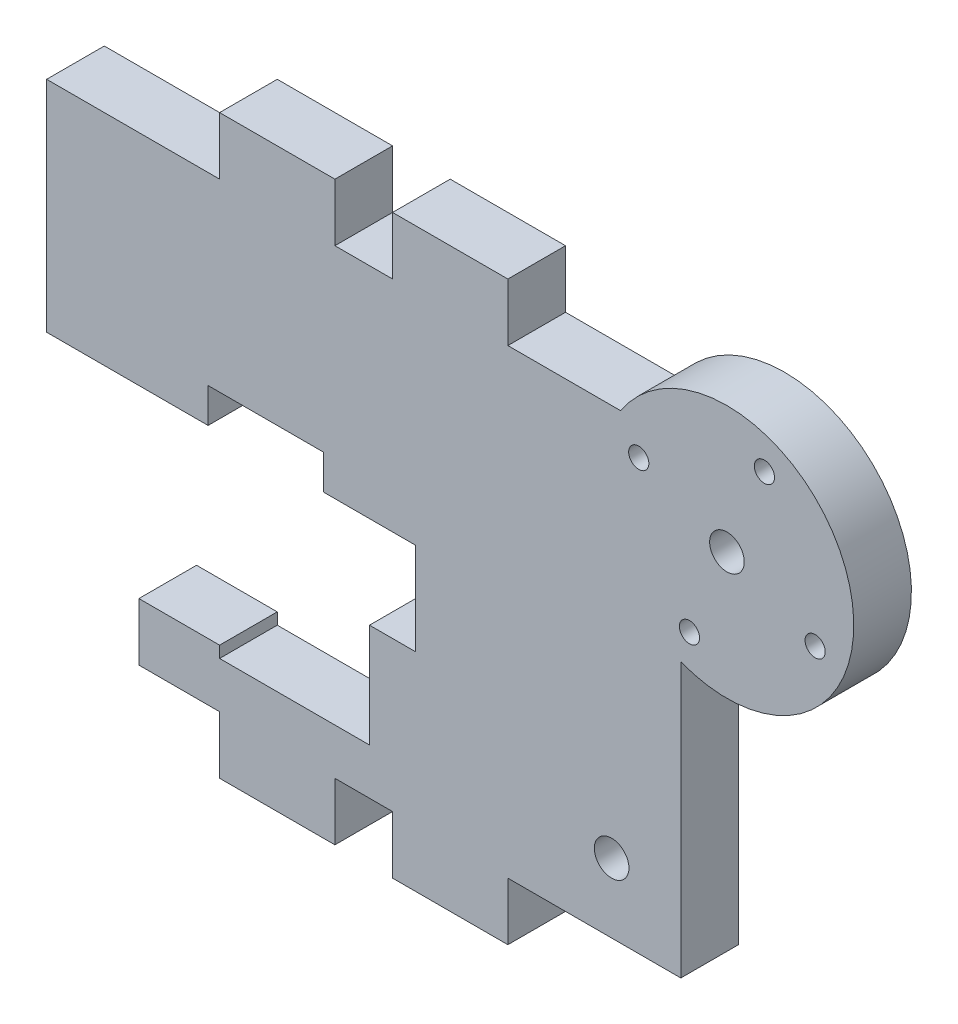
from build123d import *

# Parameters (mm, degrees)
ESQUISSE1_R        = 1.5
ESQUISSE1_R_2      = 0.875
BOSS_EXTRU_1_DEPTH = 5


with BuildPart() as part:
    # Esquisse1 → Boss.-Extru.1 (new body)
    with BuildSketch(Plane.XY):
        with BuildLine():
            Line((10, -5), (10, 0))
            Line((10, 0), (15, 0))
            Line((15, 0), (15, -5))
            Line((15, -5), (25, -5))
            Line((25, -5), (25, 0))
            Line((25, 0), (40, 0))
            Line((40, 0), (40, 23.753049234))
            ThreePointArc((40, 23.753049234), (54.472819163, 37.364529505), (34.780455543, 40))
            Line((34.780455543, 40), (25, 40))
            Line((25, 40), (25, 45))
            Line((25, 45), (15, 45))
            Line((15, 45), (15, 40))
            Line((15, 40), (10, 40))
            Line((10, 40), (10, 45))
            Line((10, 45), (0, 45))
            Line((0, 45), (0, 40))
            Line((0, 40), (-15, 40))
            Line((-15, 40), (-15, 21))
            Line((-15, 21), (-1, 21))
            Line((-1, 21), (-1, 24))
            Line((-1, 24), (9, 24))
            Line((9, 24), (9, 21))
            Line((9, 21), (17, 21))
            Line((17, 21), (17, 13))
            Line((17, 13), (13, 13))
            Line((13, 13), (13, 4))
            Line((13, 4), (0, 4))
            Line((0, 4), (0, 5))
            Line((0, 5), (-7, 5))
            Line((-7, 5), (-7, 0))
            Line((-7, 0), (0, 0))
            Line((0, 0), (0, -5))
            Line((0, -5), (10, -5))
        make_face()
        with Locations((34, 6)):
            Circle(ESQUISSE1_R, mode=Mode.SUBTRACT)
        with Locations((40.75, 26.35)):
            Circle(ESQUISSE1_R_2, mode=Mode.SUBTRACT)
        with Locations((51.65, 30.75)):
            Circle(ESQUISSE1_R_2, mode=Mode.SUBTRACT)
        with Locations((36.35, 37.25)):
            Circle(ESQUISSE1_R_2, mode=Mode.SUBTRACT)
        with Locations((44, 34)):
            Circle(ESQUISSE1_R, mode=Mode.SUBTRACT)
        with Locations((47.25, 41.65)):
            Circle(ESQUISSE1_R_2, mode=Mode.SUBTRACT)
    extrude(amount=BOSS_EXTRU_1_DEPTH)


solid = part.part
